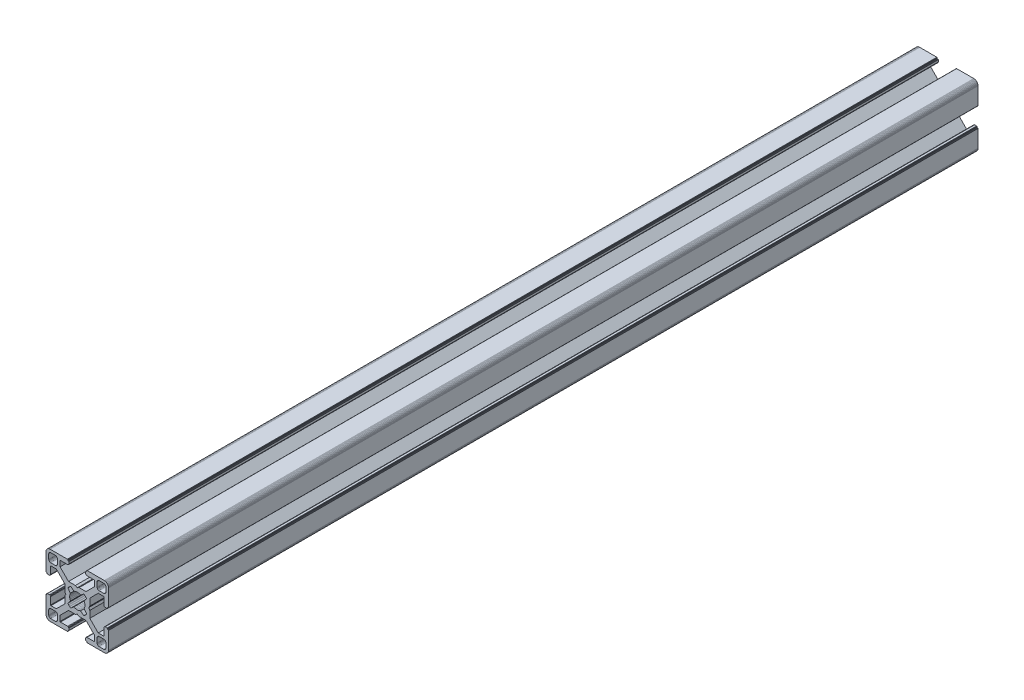
from build123d import *

# Parameters (mm, degrees)
BOSS_EXTRUDE1_DEPTH = 417


with BuildPart() as part:
    # Sketch1 → Boss-Extrude1 (new body)
    with BuildSketch(Plane.XY):
        Polygon((28.34729664, 29.969613999), (28.000000864, 29.999999329), (19.750000909, 29.999999329), (19.715268165, 29.996961355), (19.681595266, 29.987938702), (19.649999216, 29.973205179), (19.621443003, 29.953207821), (19.596790895, 29.928557575), (19.576793537, 29.899999499), (19.562061876, 29.868405312), (19.55303736, 29.834728688), (19.549999386, 29.799999669), (19.549999386, 29.699999839), (19.546961412, 29.665268958), (19.537936896, 29.631596059), (19.523203373, 29.599998146), (19.503207877, 29.571441934), (19.478557631, 29.546789825), (19.449999556, 29.526794329), (19.418403506, 29.512060806), (19.384728745, 29.503038153), (19.349999726, 29.500000179), (19.249999896, 29.500000179), (19.215267517, 29.496958527), (19.181592755, 29.487935874), (19.149996706, 29.47320235), (19.12143863, 29.453206855), (19.096788384, 29.428554746), (19.076791026, 29.399996671), (19.062057503, 29.368402484), (19.05303485, 29.334725859), (19.049996876, 29.299998703), (19.049996876, 28.39999837), (19.059110798, 28.29580945), (19.08618062, 28.194785165), (19.13038119, 28.099997016), (19.190369539, 28.014324653), (19.264324002, 27.94037019), (19.349996366, 27.88038184), (19.444784515, 27.836181271), (19.545806937, 27.809111449), (19.650010894, 27.799984574), (23.050010706, 27.799984574), (23.084741588, 27.7969466), (23.118414487, 27.787923946), (23.150012399, 27.773190423), (23.178568612, 27.753193065), (23.203220721, 27.728542819), (23.223218079, 27.699984744), (23.237949739, 27.668386831), (23.246974255, 27.634713932), (23.25001142, 27.59998608), (23.25001142, 25.049987618), (19.204474482, 20.999982084), (15.900007876, 20.999982084), (15.000008474, 20.48483404), (14.10000814, 20.999982084), (10.795543398, 20.999982084), (7.997342887, 23.801274731), (6.750011387, 25.049984589), (6.750011387, 27.599983051), (6.753049362, 27.634713932), (6.762072946, 27.668386831), (6.776805538, 27.699984744), (6.796801965, 27.728542819), (6.821454073, 27.753193065), (6.850011218, 27.773190423), (6.881607267, 27.787923946), (6.915282029, 27.7969466), (6.950011048, 27.799984574), (10.350011791, 27.799984574), (10.45420071, 27.809098497), (10.555223133, 27.836168318), (10.650011282, 27.880368888), (10.735683645, 27.940357238), (10.809638108, 28.014311701), (10.869626458, 28.099984064), (10.913827027, 28.194772213), (10.940895918, 28.295796498), (10.950010772, 28.399985417), (10.950010772, 29.299985751), (10.946974575, 29.334739239), (10.93795065, 29.368415522), (10.923215933, 29.400009153), (10.903218427, 29.428566473), (10.878566319, 29.45321765), (10.849999264, 29.473204166), (10.818403214, 29.487937689), (10.784728453, 29.496960342), (10.749999434, 29.500000179), (10.649999604, 29.500000179), (10.615270585, 29.503038153), (10.581595823, 29.512060806), (10.549999774, 29.526794329), (10.521441698, 29.546789825), (10.496791452, 29.571441934), (10.476795025, 29.599998146), (10.462061502, 29.631596059), (10.453037918, 29.665268958), (10.449999943, 29.699999839), (10.449999943, 29.799999669), (10.446961969, 29.834728688), (10.437938385, 29.868405312), (10.423205793, 29.899999499), (10.403208435, 29.928557575), (10.378557257, 29.953207821), (10.350000113, 29.973205179), (10.318404064, 29.987938702), (10.284729302, 29.996961355), (10.250000283, 29.999999329), (1.999999397, 29.999999329), (1.652702689, 29.969613999), (1.315958682, 29.879383743), (0.999999233, 29.732050374), (0.714424066, 29.532089829), (0.467910431, 29.285576195), (0.267948955, 28.999999166), (0.120614655, 28.684040532), (0.030384399, 28.34729664), (0, 28.000000864), (0, 19.750000909), (0.003037974, 19.715268165), (0.012061559, 19.681595266), (0.026795082, 19.649999216), (0.046790577, 19.621441141), (0.071442686, 19.596789032), (0.09999983, 19.576793537), (0.13159588, 19.562060013), (0.165270641, 19.55303736), (0.19999966, 19.549999386), (0.299999461, 19.549999386), (0.334728509, 19.546959549), (0.368403242, 19.537936896), (0.399999321, 19.523203373), (0.428556465, 19.503207877), (0.453208573, 19.478555769), (0.473204069, 19.449997693), (0.487937592, 19.418403506), (0.496961176, 19.384728745), (0.499999151, 19.349999726), (0.499999151, 19.249998033), (0.503038056, 19.215269014), (0.512060709, 19.181594253), (0.526794232, 19.150000066), (0.546790194, 19.121441524), (0.571441837, 19.096789882), (0.60000029, 19.076794925), (0.631595686, 19.062061999), (0.665270619, 19.053039982), (0.700000626, 19.050000801), (1.60000096, 19.050000801), (1.704189879, 19.059116587), (1.805213233, 19.086186409), (1.90000045, 19.130385115), (1.985673745, 19.190375328), (2.059627277, 19.264327928), (2.119616325, 19.350002154), (2.163816196, 19.444788441), (2.190886018, 19.545812726), (2.200000872, 19.650001645), (2.200000872, 23.050001457), (2.203039777, 23.084732338), (2.212062431, 23.118405237), (2.226795954, 23.15000315), (2.246792381, 23.178559362), (2.271443558, 23.203211471), (2.300000702, 23.223206967), (2.331596752, 23.23794049), (2.365271513, 23.246965006), (2.400001464, 23.250001117), (4.950000857, 23.250001117), (7.997332093, 20.202670812), (8.995535423, 19.204467788), (8.995535423, 15.900001182), (9.515148227, 15.00000178), (8.995535423, 14.100002378), (8.995535423, 10.795536704), (4.950000857, 6.750002138), (2.400001464, 6.750002138), (2.365271513, 6.753040112), (2.331596752, 6.762063697), (2.300000702, 6.77679722), (2.271443558, 6.796793647), (2.246792381, 6.821444824), (2.226795954, 6.850001968), (2.212062431, 6.881598018), (2.203039777, 6.915272779), (2.200000872, 6.950002729), (2.200000872, 10.350002542), (2.190896812, 10.454174265), (2.16382699, 10.555197618), (2.119627119, 10.649984836), (2.059638071, 10.735658131), (1.985684539, 10.809611663), (1.900011244, 10.869600944), (1.805224027, 10.913800582), (1.704200673, 10.940870404), (1.600011754, 10.949986189), (0.70001142, 10.949986189), (0.665281355, 10.946948596), (0.631606253, 10.937926283), (0.600010578, 10.923193954), (0.571451747, 10.903199537), (0.546799638, 10.87854836), (0.526794232, 10.850000195), (0.512060709, 10.818404146), (0.503038056, 10.784730315), (0.499999151, 10.750000365), (0.499999151, 10.650000535), (0.496961176, 10.615270585), (0.487937592, 10.581596754), (0.473204069, 10.550000705), (0.453208573, 10.521443561), (0.428556465, 10.496791452), (0.399999321, 10.476795956), (0.368403242, 10.462062433), (0.334728509, 10.453038849), (0.299999461, 10.449999943), (0.19999966, 10.449999943), (0.165270641, 10.446961969), (0.13159588, 10.437939316), (0.09999983, 10.423205793), (0.071442686, 10.403209366), (0.046790577, 10.378558189), (0.026795082, 10.350000113), (0.012061559, 10.318404064), (0.003037974, 10.284729302), (0, 10.250000283), (0, 1.999999397), (0.030384399, 1.652702689), (0.120614655, 1.315958682), (0.267948955, 0.999999233), (0.467910431, 0.714424066), (0.714424066, 0.467910431), (0.999999233, 0.267948955), (1.315958682, 0.120614655), (1.652702689, 0.030384399), (1.999999397, 0), (10.250000283, 0), (10.284729302, 0.003037974), (10.318404064, 0.012061559), (10.350000113, 0.026795082), (10.378557257, 0.046790577), (10.403208435, 0.071442686), (10.423205793, 0.09999983), (10.437938385, 0.13159588), (10.446961969, 0.165270641), (10.449999943, 0.19999966), (10.449999943, 0.300000422), (10.453037918, 0.334729441), (10.462061502, 0.368404202), (10.476795025, 0.400000252), (10.496791452, 0.428557396), (10.521441698, 0.453208573), (10.549999774, 0.473205), (10.581595823, 0.487938523), (10.615270585, 0.496961176), (10.649999604, 0.500000082), (10.749999434, 0.500000082), (10.784728453, 0.503038056), (10.818403214, 0.512060709), (10.849999264, 0.526794232), (10.878547894, 0.546800104), (10.903198606, 0.571451747), (10.923194493, 0.6000102), (10.93792742, 0.631606528), (10.946949437, 0.66528146), (10.950010772, 0.699984975), (10.950010772, 1.599985308), (10.940895918, 1.704174228), (10.913827027, 1.805197581), (10.869626458, 1.89998573), (10.809638108, 1.985658094), (10.735683645, 2.059612557), (10.650011282, 2.119600674), (10.555223133, 2.163801476), (10.45420071, 2.190870367), (10.350011791, 2.199985221), (6.950011048, 2.199985221), (6.915282029, 2.203024126), (6.881607267, 2.212046779), (6.850011218, 2.226780302), (6.821454073, 2.246776729), (6.796801965, 2.271427907), (6.776805538, 2.299985982), (6.762072946, 2.331582032), (6.753049362, 2.365256793), (6.750011387, 2.399985812), (6.750011387, 4.949985206), (9.787457566, 7.990785077), (10.795545277, 8.999985833), (14.100010019, 8.999985833), (15.000010353, 9.515133877), (15.900009756, 8.999985833), (19.204476361, 8.999985833), (20.21256413, 7.990786065), (23.25001142, 4.949988235), (23.25001142, 2.399988841), (23.246974255, 2.365256793), (23.237949739, 2.331582032), (23.223218079, 2.299985982), (23.203220721, 2.271427907), (23.178568612, 2.246776729), (23.150012399, 2.226780302), (23.118414487, 2.212046779), (23.084741588, 2.203024126), (23.050010706, 2.199985221), (19.650010894, 2.199985221), (19.545806937, 2.190883319), (19.444784515, 2.163814428), (19.349996366, 2.119613626), (19.264324002, 2.059625509), (19.190369539, 1.985671046), (19.13038119, 1.899998682), (19.08618062, 1.805210533), (19.059110798, 1.70418718), (19.049996876, 1.599998261), (19.049996876, 0.699997927), (19.053035506, 0.665268966), (19.062058795, 0.631594374), (19.076792915, 0.599998603), (19.096790813, 0.571440905), (19.121441524, 0.546790194), (19.149999978, 0.526794306), (19.181596306, 0.51206138), (19.215271238, 0.503039363), (19.249999896, 0.500000082), (19.349999726, 0.500000082), (19.384728745, 0.496961176), (19.418403506, 0.487938523), (19.449999556, 0.473205), (19.478557631, 0.453208573), (19.503207877, 0.428557396), (19.523203373, 0.400000252), (19.537936896, 0.368404202), (19.546961412, 0.334729441), (19.549999386, 0.300000422), (19.549999386, 0.19999966), (19.55303736, 0.165270641), (19.562061876, 0.13159588), (19.576793537, 0.09999983), (19.596789964, 0.071441755), (19.621442072, 0.046789646), (19.649998285, 0.02679415), (19.681594335, 0.012060627), (19.715267234, 0.003037043), (19.750000909, 0), (28.000000864, 0), (28.34729664, 0.030384399), (28.684040532, 0.120614655), (28.999999166, 0.267948955), (29.285576195, 0.467910431), (29.532089829, 0.714424066), (29.732050374, 0.999999233), (29.879383743, 1.315958682), (29.969613999, 1.652702689), (29.999999329, 1.999999397), (29.999999329, 10.250000283), (29.996974806, 10.284715361), (29.987951516, 10.318389952), (29.973217396, 10.349985723), (29.953219499, 10.378543421), (29.928568787, 10.403194133), (29.899999499, 10.423205793), (29.868405312, 10.437939316), (29.834728688, 10.446961969), (29.799999669, 10.449999943), (29.699999839, 10.449999943), (29.664909937, 10.453400043), (29.631233313, 10.462423628), (29.599637263, 10.477157151), (29.57108105, 10.497152646), (29.546427079, 10.521804755), (29.526433446, 10.550361899), (29.511699923, 10.581957949), (29.502675407, 10.615631779), (29.499637433, 10.650361729), (29.499637433, 10.750361559), (29.49697202, 10.784715548), (29.487949367, 10.818389378), (29.473215844, 10.849985428), (29.453220348, 10.878542572), (29.428568239, 10.90319468), (29.400010164, 10.923190176), (29.368415977, 10.937923699), (29.334741215, 10.946947284), (29.300012197, 10.949986189), (28.400011863, 10.949986189), (28.29581215, 10.9408876), (28.194787865, 10.913817778), (28.099999716, 10.86961814), (28.014327352, 10.809628859), (27.940374752, 10.735675327), (27.880384539, 10.650002032), (27.836185833, 10.555214814), (27.809114148, 10.454191461), (27.800000225, 10.350002542), (27.800000225, 6.950002729), (27.796962251, 6.915272779), (27.787939598, 6.881598018), (27.773206075, 6.850001968), (27.753208716, 6.821444824), (27.728558471, 6.796793647), (27.700000395, 6.77679722), (27.668404345, 6.762063697), (27.634729584, 6.753040112), (27.599998702, 6.750002138), (25.05000024, 6.750002138), (23.809199132, 7.99080223), (21.004464477, 10.795534588), (21.004464477, 14.100000262), (20.484851673, 14.999999665), (21.004464477, 15.899999067), (21.004464477, 19.204465672), (25.05000024, 23.250001117), (27.599998702, 23.250001117), (27.634729584, 23.246965006), (27.668404345, 23.23794049), (27.700000395, 23.223206967), (27.728558471, 23.203211471), (27.753208716, 23.178559362), (27.773206075, 23.15000315), (27.787939598, 23.118405237), (27.796962251, 23.084732338), (27.800000225, 23.050001457), (27.800000225, 19.650001645), (27.809114148, 19.545812726), (27.836185833, 19.444788441), (27.880384539, 19.350002154), (27.940370508, 19.264323684), (28.014323108, 19.190371084), (28.099995472, 19.130380872), (28.194783621, 19.086182165), (28.295807906, 19.059112343), (28.400001069, 19.050000801), (29.300001402, 19.050000801), (29.334730421, 19.053040638), (29.368405183, 19.062063291), (29.39999937, 19.076796814), (29.42819671, 19.097149726), (29.452848353, 19.1218023), (29.472843309, 19.150360754), (29.487576235, 19.181955219), (29.496598252, 19.215630151), (29.499637433, 19.250359227), (29.499637433, 19.35036092), (29.502675407, 19.385089939), (29.511699923, 19.4187647), (29.526433446, 19.450358887), (29.546427079, 19.478916963), (29.57108105, 19.503569071), (29.599637263, 19.523564567), (29.631233313, 19.53829809), (29.664909937, 19.547320743), (29.699999839, 19.549999386), (29.799999669, 19.549999386), (29.834728688, 19.55303736), (29.868405312, 19.562060013), (29.899999499, 19.576793537), (29.928557575, 19.596789032), (29.953207821, 19.621441141), (29.973205179, 19.649999216), (29.987938702, 19.681595266), (29.996961355, 19.715268165), (29.999999329, 19.750000909), (29.999999329, 28.000000864), (29.969613999, 28.34729664), (29.879383743, 28.684040532), (29.732050374, 28.999999166), (29.532089829, 29.285576195), (29.285576195, 29.532089829), (28.999999166, 29.732050374), (28.684040532, 29.879383743), align=None)
        Polygon((1.299998723, 25.499999523), (1.299998723, 27.699999511), (1.312309876, 27.856435627), (1.348942518, 28.009016067), (1.408992335, 28.153989464), (1.490981318, 28.287785128), (1.592892222, 28.407108039), (1.71221327, 28.50901708), (1.846008119, 28.591006994), (1.9909814, 28.651056811), (2.143563703, 28.687689453), (2.299998887, 28.699999675), (4.499998875, 28.699999675), (4.656434059, 28.687689453), (4.809016362, 28.651056811), (4.953989759, 28.591006994), (5.087784491, 28.50901708), (5.207106471, 28.407108039), (5.309016444, 28.287785128), (5.391005427, 28.153989464), (5.451056175, 28.009016067), (5.487687886, 27.856435627), (5.499999039, 27.699999511), (5.499999039, 25.499999523), (5.487687886, 25.34356527), (5.451056175, 25.190982968), (5.391005427, 25.04600957), (5.309016444, 24.912213907), (5.207106471, 24.792892858), (5.087784491, 24.690981954), (4.953989759, 24.60899204), (4.809016362, 24.548944086), (4.656434059, 24.512309581), (4.499998875, 24.499999359), (2.299998887, 24.499999359), (2.143563703, 24.512309581), (1.9909814, 24.548944086), (1.846008119, 24.60899204), (1.71221327, 24.690981954), (1.592892222, 24.792892858), (1.490981318, 24.912213907), (1.408992335, 25.04600957), (1.348942518, 25.190982968), (1.312309876, 25.34356527), align=None, mode=Mode.SUBTRACT)
        Polygon((25.34356527, 28.687689453), (25.499999523, 28.699999675), (27.699999511, 28.699999675), (27.856435627, 28.687689453), (28.009017929, 28.651056811), (28.153991327, 28.591006994), (28.28778699, 28.50901708), (28.407108039, 28.407108039), (28.50901708, 28.287785128), (28.591006994, 28.153989464), (28.651056811, 28.009016067), (28.687689453, 27.856435627), (28.700001538, 27.699999511), (28.700001538, 25.499999523), (28.687689453, 25.34356527), (28.651056811, 25.190982968), (28.591006994, 25.04600957), (28.50901708, 24.912213907), (28.407108039, 24.792892858), (28.28778699, 24.690981954), (28.153991327, 24.60899204), (28.009017929, 24.548944086), (27.856435627, 24.512309581), (27.699999511, 24.499999359), (25.499999523, 24.499999359), (25.34356527, 24.512309581), (25.190982968, 24.548944086), (25.04600957, 24.60899204), (24.912215769, 24.690981954), (24.792892858, 24.792892858), (24.690981954, 24.912213907), (24.608993903, 25.04600957), (24.548944086, 25.190982968), (24.512311444, 25.34356527), (24.500001222, 25.499999523), (24.500001222, 27.699999511), (24.512311444, 27.856435627), (24.548944086, 28.009016067), (24.608993903, 28.153989464), (24.690981954, 28.287785128), (24.792892858, 28.407108039), (24.912215769, 28.50901708), (25.04600957, 28.591006994), (25.190982968, 28.651056811), align=None, mode=Mode.SUBTRACT)
        Polygon((14.999999665, 18.649999052), (15.550030395, 18.608318642), (16.087498516, 18.484227359), (16.600128263, 18.280562013), (18.13592948, 19.518401474), (18.644984812, 19.11874488), (19.103571773, 18.662061542), (19.505336881, 18.154669553), (18.280562013, 16.600130126), (18.484227359, 16.087498516), (18.608318642, 15.550030395), (18.649999052, 14.999999665), (18.608318642, 14.449968934), (18.484227359, 13.912500814), (18.280562013, 13.399870135), (19.505336881, 11.845329776), (19.103571773, 11.337937787), (18.644984812, 10.881252587), (18.13592948, 10.481598787), (16.600128263, 11.719437316), (16.087498516, 11.515771039), (15.550030395, 11.391680688), (14.999999665, 11.349999346), (14.449968934, 11.391680688), (13.912500814, 11.515771039), (13.399870135, 11.719437316), (11.864069849, 10.481598787), (11.355013587, 10.881252587), (10.896427557, 11.337937787), (10.494662449, 11.845329776), (11.719438247, 13.399870135), (11.515771039, 13.912500814), (11.391680688, 14.449968934), (11.349999346, 14.999999665), (11.391680688, 15.550030395), (11.515771039, 16.087498516), (11.719438247, 16.600130126), (10.494662449, 18.154669553), (10.896427557, 18.662061542), (11.355013587, 19.11874488), (11.864069849, 19.518401474), (13.399870135, 18.280562013), (13.912500814, 18.484227359), (14.449968934, 18.608318642), align=None, mode=Mode.SUBTRACT)
        Polygon((4.499998875, 1.299999771), (2.299998887, 1.299999771), (2.143563703, 1.312310807), (1.9909814, 1.348942518), (1.846008119, 1.408992335), (1.71221327, 1.490982249), (1.592892222, 1.592892222), (1.490981318, 1.712214202), (1.408992335, 1.846008934), (1.348942518, 1.990982331), (1.312309876, 2.143564634), (1.299998723, 2.299998887), (1.299998723, 4.499999806), (1.312309876, 4.656434059), (1.348942518, 4.809017293), (1.408992335, 4.95399069), (1.490981318, 5.087785423), (1.592892222, 5.207106471), (1.71221327, 5.309017375), (1.846008119, 5.391006358), (1.9909814, 5.451056175), (2.143563703, 5.487688817), (2.299998887, 5.49999997), (4.499998875, 5.49999997), (4.656434059, 5.487688817), (4.809016362, 5.451056175), (4.953989759, 5.391006358), (5.087784491, 5.309017375), (5.207106471, 5.207106471), (5.309016444, 5.087785423), (5.391005427, 4.95399069), (5.451056175, 4.809017293), (5.487687886, 4.656434059), (5.499999039, 4.499999806), (5.499999039, 2.299998887), (5.487687886, 2.143564634), (5.451056175, 1.990982331), (5.391005427, 1.846008934), (5.309016444, 1.712214202), (5.207106471, 1.592892222), (5.087784491, 1.490982249), (4.953989759, 1.408992335), (4.809016362, 1.348942518), (4.656434059, 1.312310807), align=None, mode=Mode.SUBTRACT)
        Polygon((27.699999511, 1.299999771), (25.499999523, 1.299999771), (25.34356527, 1.312310807), (25.190982968, 1.348942518), (25.04600957, 1.408992335), (24.912215769, 1.490982249), (24.792892858, 1.592892222), (24.690981954, 1.712214202), (24.608993903, 1.846008934), (24.548944086, 1.990982331), (24.512311444, 2.143564634), (24.500001222, 2.299998887), (24.500001222, 4.499999806), (24.512311444, 4.656434059), (24.548944086, 4.809017293), (24.608993903, 4.95399069), (24.690981954, 5.087785423), (24.792892858, 5.207106471), (24.912215769, 5.309017375), (25.04600957, 5.391006358), (25.190982968, 5.451056175), (25.34356527, 5.487688817), (25.499999523, 5.49999997), (27.699999511, 5.49999997), (27.856435627, 5.487688817), (28.009017929, 5.451056175), (28.153991327, 5.391006358), (28.28778699, 5.309017375), (28.407108039, 5.207106471), (28.50901708, 5.087785423), (28.591006994, 4.95399069), (28.651056811, 4.809017293), (28.687689453, 4.656434059), (28.700001538, 4.499999806), (28.700001538, 2.299998887), (28.687689453, 2.143564634), (28.651056811, 1.990982331), (28.591006994, 1.846008934), (28.50901708, 1.712214202), (28.407108039, 1.592892222), (28.28778699, 1.490982249), (28.153991327, 1.408992335), (28.009017929, 1.348942518), (27.856435627, 1.312310807), align=None, mode=Mode.SUBTRACT)
    extrude(amount=-BOSS_EXTRUDE1_DEPTH)


solid = part.part
